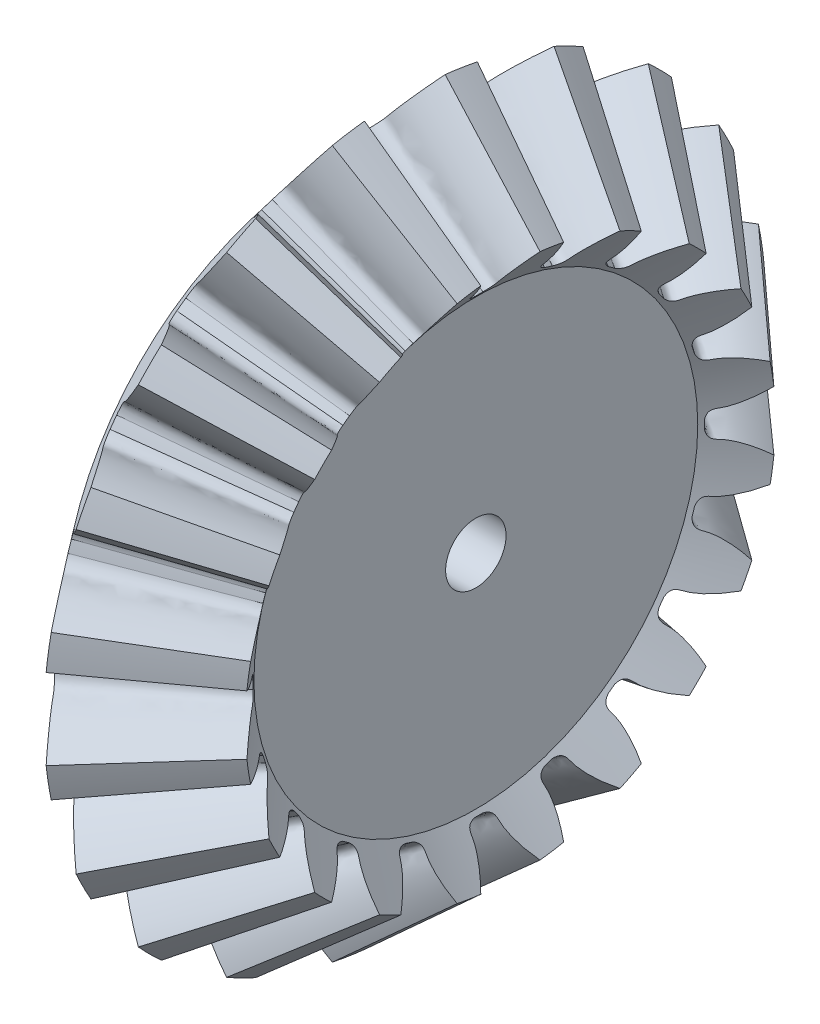
from build123d import *

# Parameters (mm, degrees)
PATTERN_CIRCULAR_1_COUNT = 20


# Read off the part's stored shape, not the designer's step: 旋转1
with BuildPart() as part:
    # 旋转1 outline → 旋转1 (revolve)
    with BuildSketch(Plane.YX):
        Polygon((1.804782798, 12.973712191), (16.217140239, 12.973712191), (21.561737619, 17.249390095), (15.837195568, 23.555067658), (13.256212755, 21.490281408), (1.804782798, 21.490281408), align=None)
    revolve(axis=Axis((0, 0, 0), (1, 0, 0)))

    # 草图6 → 切除-放样1 section 0
    with BuildSketch(Plane(origin=(0, 0, 0), x_dir=(0, 0, -1), z_dir=(0.7808688094430307, -0.6246950475544236, -1.0341155355510722e-13)), mode=Mode.PRIVATE) as loft_1_s0:
        with BuildLine():
            ThreePointArc((0.334166203, 23.497623985), (0, 23.5), (-0.334166203, 23.497623985))
            add(Edge.make_bspline(
                [(-0.334166203, 23.497623985), (-1.126249154, 23.647573059), (-1.060682993, 24.115894486), (-1.134806649, 24.58436917), (-1.145940464, 24.646912416), (-1.160233381, 24.718805072), (-1.178047812, 24.799945437), (-1.199763487, 24.890216464), (-1.225750213, 24.989491134), (-1.256376305, 25.097630828), (-1.292005509, 25.214485967), (-1.332997575, 25.339895945), (-1.379707694, 25.473689291), (-1.432486291, 25.615683768), (-1.491678707, 25.765686504), (-1.557624929, 25.923494124), (-1.6306593, 26.088892886), (-1.711110243, 26.261658827), (-1.79929999, 26.441557916), (-1.895544305, 26.628346218), (-2.000152224, 26.821770052), (-2.113425787, 27.02156617), (-2.235659783, 27.227461935), (-2.367141495, 27.439175509), (-2.508150449, 27.656416042), (-2.658958171, 27.878883872), (-2.819827949, 28.106270733), (-2.991014594, 28.338259962), (-3.172764214, 28.574526716), (-3.365313988, 28.8147382), (-3.568891947, 29.058553888), (-3.783716762, 29.305625763), (-4.009997535, 29.555598554), (-4.2479336, 29.80810998), (-4.497714323, 30.062791), (-4.759518919, 30.31926607), (-5.033516256, 30.5771534), (-5.31986471, 30.836065219), (-5.618711894, 31.095608048), (-6.039026251, 31.446147682), (-6.365991342, 31.702419987), (-6.589818312, 31.870903728)],
                knots=[0, 0, 0, 0, 0.122665365, 0.127715434, 0.133683697, 0.140570154, 0.148374806, 0.157097651, 0.166738691, 0.177297926, 0.188775354, 0.201170977, 0.214484794, 0.228716806, 0.243867011, 0.259935411, 0.276922005, 0.294826794, 0.313649777, 0.333390954, 0.354050325, 0.37562789, 0.39812365, 0.421537604, 0.445869753, 0.471120096, 0.497288632, 0.524375364, 0.552380289, 0.581303409, 0.611144723, 0.641904231, 0.673581934, 0.706177831, 0.739691922, 0.774124208, 0.809474687, 0.845743361, 0.88293023, 0.921035292, 1, 1, 1, 1], degree=3))
            ThreePointArc((-6.589818312, 31.870903728), (0, 32.54504893), (6.589818312, 31.870903728))
            add(Edge.make_bspline(
                [(0.334166203, 23.497623985), (1.126249154, 23.647573059), (1.060682993, 24.115894486), (1.134806649, 24.58436917), (1.145940464, 24.646912416), (1.160233381, 24.718805072), (1.178047812, 24.799945437), (1.199763487, 24.890216464), (1.225750213, 24.989491134), (1.256376305, 25.097630828), (1.292005509, 25.214485967), (1.332997575, 25.339895945), (1.379707694, 25.473689291), (1.432486291, 25.615683768), (1.491678707, 25.765686504), (1.557624929, 25.923494124), (1.6306593, 26.088892886), (1.711110243, 26.261658827), (1.79929999, 26.441557916), (1.895544305, 26.628346218), (2.000152224, 26.821770052), (2.113425787, 27.02156617), (2.235659783, 27.227461935), (2.367141495, 27.439175509), (2.508150449, 27.656416042), (2.658958171, 27.878883872), (2.819827949, 28.106270733), (2.991014594, 28.338259962), (3.172764214, 28.574526716), (3.365313988, 28.8147382), (3.568891947, 29.058553888), (3.783716762, 29.305625763), (4.009997535, 29.555598554), (4.2479336, 29.80810998), (4.497714323, 30.062791), (4.759518919, 30.31926607), (5.033516256, 30.5771534), (5.31986471, 30.836065219), (5.618711894, 31.095608048), (6.039026251, 31.446147682), (6.365991342, 31.702419987), (6.589818312, 31.870903728)],
                knots=[0, 0, 0, 0, 0.122665365, 0.127715434, 0.133683697, 0.140570154, 0.148374806, 0.157097651, 0.166738691, 0.177297926, 0.188775354, 0.201170977, 0.214484794, 0.228716806, 0.243867011, 0.259935411, 0.276922005, 0.294826794, 0.313649777, 0.333390954, 0.354050325, 0.37562789, 0.39812365, 0.421537604, 0.445869753, 0.471120096, 0.497288632, 0.524375364, 0.552380289, 0.581303409, 0.611144723, 0.641904231, 0.673581934, 0.706177831, 0.739691922, 0.774124208, 0.809474687, 0.845743361, 0.88293023, 0.921035292, 1, 1, 1, 1], degree=3))
        make_face()
    loft_1 = loft([loft_1_s0.sketch, Vertex(41, 0, 0)], mode=Mode.SUBTRACT)

    # 阵列(圆周)1: 切除-放样1 ×20 about axis
    pattern_circular_1_axis = Axis((43.05, 0, 0), (-1, 0, 0))
    for i in range(1, PATTERN_CIRCULAR_1_COUNT):
        add(loft_1.rotate(pattern_circular_1_axis, i * 360 / PATTERN_CIRCULAR_1_COUNT), mode=Mode.SUBTRACT)


solid = part.part
